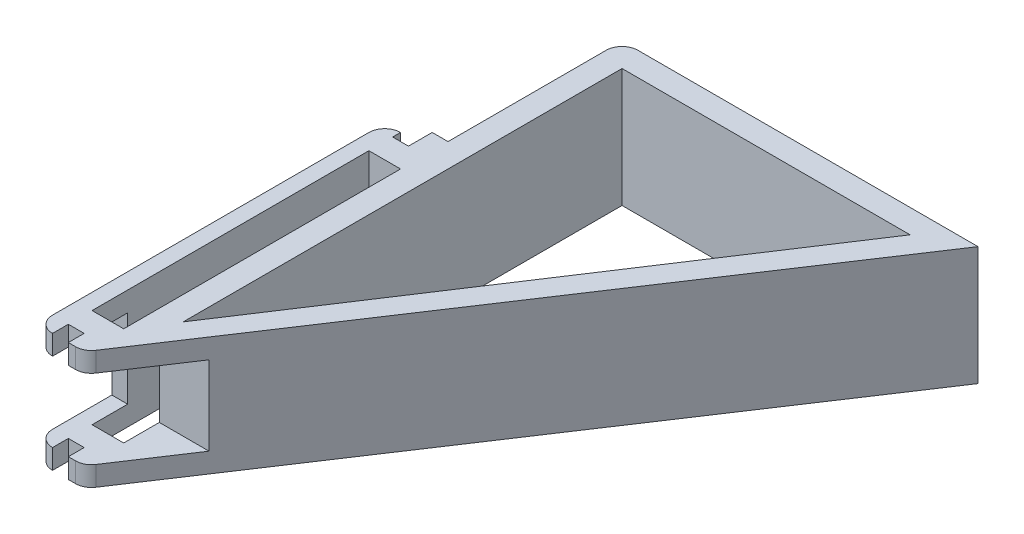
from build123d import *

# Parameters (mm, degrees)
SKETCH2_W               = 4
SKETCH2_H               = 35
BOSS_EXTRUDE1_DEPTH     = 15
CUT_EXTRUDE1_DEPTH      = 87.313382508
CUT_EXTRUDE1_DEPTH_BACK = 15
SKETCH3_W               = 9.5
SKETCH3_H               = 10
FILLET1_R               = 2
FILLET2_R               = 2
FILLET3_R               = 2
FILLET4_R               = 2
FILLET5_R               = 2
FILLET6_R               = 2


with BuildPart() as part:
    # Sketch2 → Boss-Extrude1 (new body)
    with BuildSketch(Plane(origin=(0, 0, 0), x_dir=(1, 0, 0), z_dir=(0, 1, 0))):
        Polygon((0, 0), (0, 2), (2, 2), (2, 0), (4, 0), (49, 68), (4, 68), (4, 46), (2, 46), (2, 43), (0, 43), (0, 44), (-2, 44), (-2, 0), align=None)
        with Locations((2, 22.5)):
            Rectangle(SKETCH2_W, SKETCH2_H, mode=Mode.SUBTRACT)
        Polygon((7, 65), (43.417291153, 65), (7, 9.516238481), align=None, mode=Mode.SUBTRACT)
    extrude(amount=BOSS_EXTRUDE1_DEPTH)

    # Sketch3 → Cut-Extrude1 (cut, two sides: drawn at the far end of the back side and taken through both)
    with BuildSketch(Plane.ZY.offset(2).offset(-CUT_EXTRUDE1_DEPTH_BACK)):
        with Locations((-4.75, 7.5)):
            Rectangle(SKETCH3_W, SKETCH3_H)
    extrude(amount=CUT_EXTRUDE1_DEPTH + CUT_EXTRUDE1_DEPTH_BACK, mode=Mode.SUBTRACT)

    # Fillet1
    fillet1_edges = [part.edges().sort_by_distance(p)[0] for p in [
        (-2, 7.5, -44),
    ]]
    fillet(fillet1_edges, radius=FILLET1_R - 0.0001)  # a hair under: the kernel refuses the full size

    # Fillet2
    fillet2_edges = [part.edges().sort_by_distance(p)[0] for p in [
        (4, 7.5, -68),
    ]]
    fillet(fillet2_edges, radius=FILLET2_R)

    # Fillet3
    fillet3_edges = [part.edges().sort_by_distance(p)[0] for p in [
        (4, 1.25, 0),
    ]]
    fillet(fillet3_edges, radius=FILLET3_R)

    # Fillet4
    fillet4_edges = [part.edges().sort_by_distance(p)[0] for p in [
        (4, 13.75, 0),
    ]]
    fillet(fillet4_edges, radius=FILLET4_R)

    # Fillet5
    fillet5_edges = [part.edges().sort_by_distance(p)[0] for p in [
        (-2, 13.75, 0),
    ]]
    fillet(fillet5_edges, radius=FILLET5_R - 0.0001)  # a hair under: the kernel refuses the full size

    # Fillet6
    fillet6_edges = [part.edges().sort_by_distance(p)[0] for p in [
        (-2, 1.25, 0),
    ]]
    fillet(fillet6_edges, radius=FILLET6_R - 0.0001)  # a hair under: the kernel refuses the full size


solid = part.part
